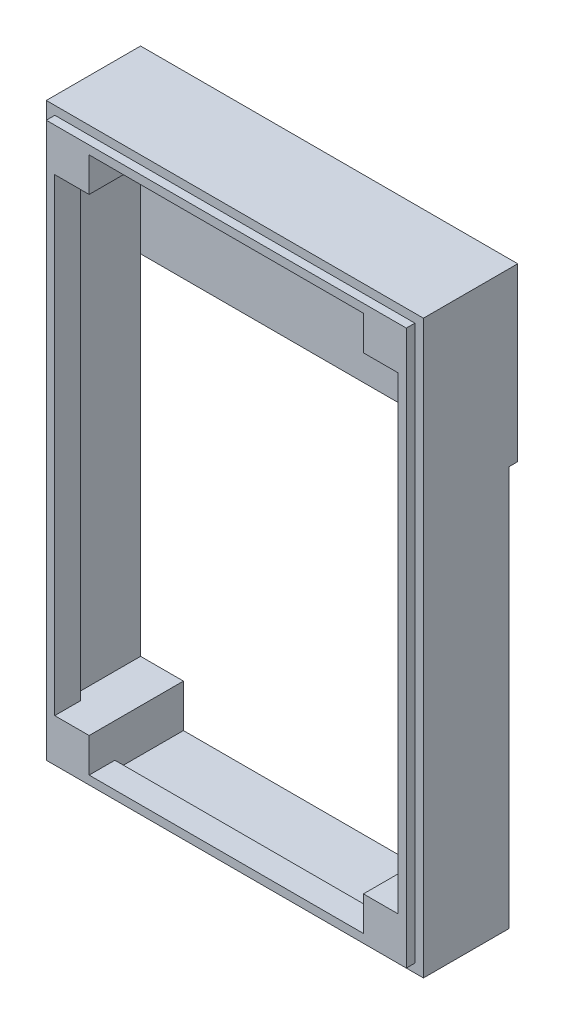
from build123d import *

# Parameters (mm, degrees)
SKETCH_1_W           = 66
SKETCH_1_H           = 100
SKETCH_1_W_2         = 63
SKETCH_1_H_2         = 97
EXTRUDE_1_DEPTH      = 15
SKETCH_2_W           = 7.5
SKETCH_2_H           = 7.5
EXTRUDE_2_DEPTH      = 16.5
SKETCH_3_W           = 66
SKETCH_3_H           = 30
EXTRUDE_3_DEPTH      = 1.5
EXTRUDE_9_DEPTH      = 1.5
EXTRUDE_9_DEPTH_BACK = 3
SKETCH_5_W           = 63
SKETCH_5_H           = 97
SKETCH_5_W_2         = 60.049401812
SKETCH_5_H_2         = 94


with BuildPart() as part:
    # Эскиз1 → Бобышка-Вытянуть1 (new body)
    with BuildSketch(Plane.XY):
        Rectangle(SKETCH_1_W, SKETCH_1_H)
        Rectangle(SKETCH_1_W_2, SKETCH_1_H_2, mode=Mode.SUBTRACT)
    extrude(amount=EXTRUDE_1_DEPTH)

    # Эскиз2 → Бобышка-Вытянуть2 (add)
    with BuildSketch(Plane(origin=(0, 0, 0), x_dir=(-1, 0, 0), z_dir=(0, 0, -1))):
        with Locations((-27.75, 44.75)):
            Rectangle(SKETCH_2_W, SKETCH_2_H)
        with Locations((27.75, 44.75)):
            Rectangle(SKETCH_2_W, SKETCH_2_H)
        with Locations((-27.75, -44.75)):
            Rectangle(SKETCH_2_W, SKETCH_2_H)
        with Locations((27.75, -44.75)):
            Rectangle(SKETCH_2_W, SKETCH_2_H)
    extrude(amount=-EXTRUDE_2_DEPTH)

    # Эскиз3 → Бобышка-Вытянуть3 (add)
    with BuildSketch(Plane(origin=(0, 0, 0), x_dir=(-1, 0, 0), z_dir=(0, 0, -1))):
        with Locations((0, 35)):
            Rectangle(SKETCH_3_W, SKETCH_3_H)
    extrude(amount=EXTRUDE_3_DEPTH)

    # Эскиз5 → Бобышка-Вытянуть9 (add, two sides: drawn at the far end of the back side and taken through both)
    with BuildSketch(Plane.XY.offset(15).offset(-EXTRUDE_9_DEPTH_BACK)):
        Rectangle(SKETCH_5_W, SKETCH_5_H)
        Rectangle(SKETCH_5_W_2, SKETCH_5_H_2, mode=Mode.SUBTRACT)
    extrude(amount=EXTRUDE_9_DEPTH + EXTRUDE_9_DEPTH_BACK)


solid = part.part
